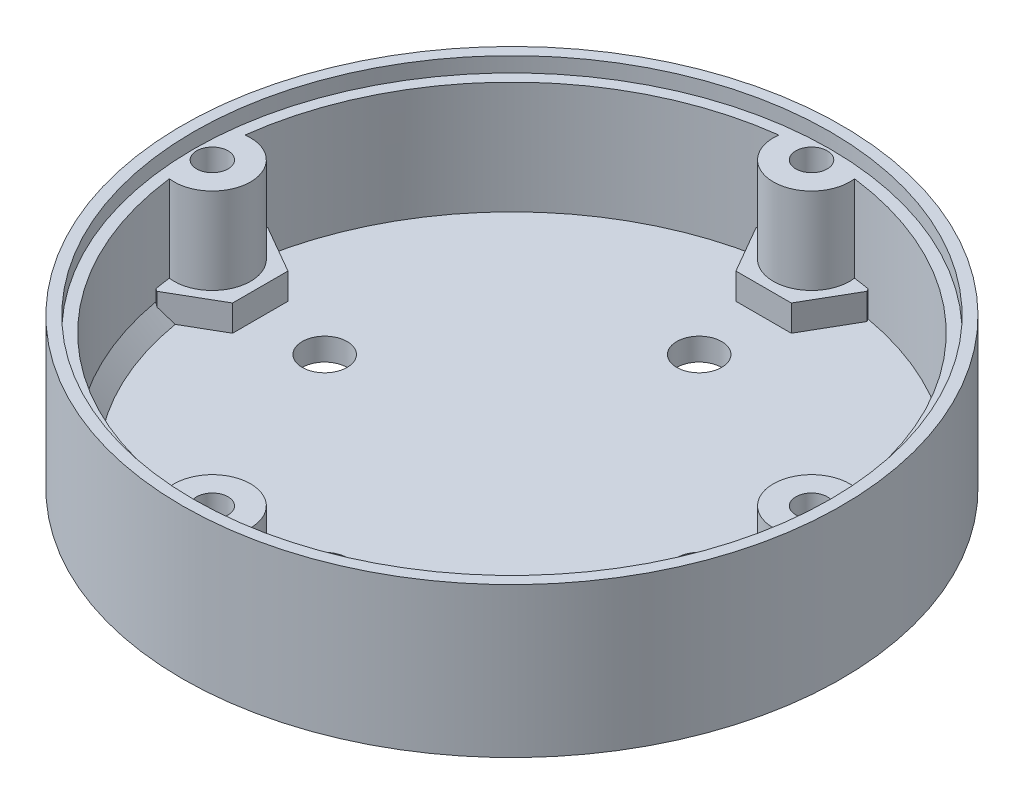
from build123d import *

# Parameters (mm, degrees)
CROQUIS1_R              = 44
SALIENTE_EXTRUIR1_DEPTH = 20
CROQUIS3_R              = 2.1
CORTAR_EXTRUIR3_DEPTH   = 81.199750623
CORTAR_EXTRUIR5_DEPTH   = 3.5
VACIADO1_START          = 3
VACIADO1_DEPTH          = 17
VACIADO1_START_2        = 6.5
VACIADO1_2_DEPTH        = 13.5
CROQUIS2_R              = 3
CORTAR_EXTRUIR1_DEPTH   = 66.360538553
CROQUIS4_R              = 42.5
CORTAR_EXTRUIR4_DEPTH   = 2
CHAFL_N1_SIZE           = 2


# Read off the part's stored shape, not the designer's step: Vaciado1
with BuildPart() as part:
    # Croquis1 → Saliente-Extruir1 (new body)
    with BuildSketch(Plane(origin=(0, 0, 0), x_dir=(1, 0, 0), z_dir=(0, 1, 0))):
        with Locations(Location((0, 0, 0), (0, 0, 270))):
            Circle(CROQUIS1_R)
    extrude(amount=SALIENTE_EXTRUIR1_DEPTH)

    # Croquis3 → Cortar-Extruir3 (cut, through all)
    with BuildSketch(Plane(origin=(0, 20, -20), x_dir=(1, 0, 0), z_dir=(0, -1, 0))):
        with Locations(Location((-40, 20, 0), (0, 0, 270))):
            Circle(CROQUIS3_R)
        with Locations(Location((0, 60, 0), (0, 0, 270))):
            Circle(CROQUIS3_R)
        with Locations(Location((40, 20, 0), (0, 0, 270))):
            Circle(CROQUIS3_R)
        with Locations(Location((0, -20, 0), (0, 0, 270))):
            Circle(CROQUIS3_R)
    extrude(amount=CORTAR_EXTRUIR3_DEPTH, mode=Mode.SUBTRACT)

    # Croquis5 → Cortar-Extruir5 (cut)
    with BuildSketch(Plane.XZ):
        Polygon((40, -3.92598183), (43.4, -1.962990915), (43.4, 1.962990915), (40, 3.92598183), (36.6, 1.962990915), (36.6, -1.962990915), align=None)
        Polygon((3.92598183, 40), (1.962990915, 43.4), (-1.962990915, 43.4), (-3.92598183, 40), (-1.962990915, 36.6), (1.962990915, 36.6), align=None)
        Polygon((-3.92598183, -40), (-1.962990915, -43.4), (1.962990915, -43.4), (3.92598183, -40), (1.962990915, -36.6), (-1.962990915, -36.6), align=None)
        Polygon((-40, 3.92598183), (-43.4, 1.962990915), (-43.4, -1.962990915), (-40, -3.92598183), (-36.6, -1.962990915), (-36.6, 1.962990915), align=None)
    extrude(amount=-CORTAR_EXTRUIR5_DEPTH, mode=Mode.SUBTRACT)

    # Vaciado1 outline → Vaciado1 (cut)
    with BuildSketch(Plane(origin=(0, 0, 0), x_dir=(1, 0, 0), z_dir=(0, 1, 0)).offset(VACIADO1_START)):
        with BuildLine():
            ThreePointArc((-7.178364733, 40.366707567), (-28.991378029, 28.991378029), (-40.366707567, 7.178364733))
            Line((-40.366707567, 7.178364733), (-40, 7.390083446))
            Line((-40, 7.390083446), (-33.6, 3.695041723))
            Line((-33.6, 3.695041723), (-33.6, -3.695041723))
            Line((-33.6, -3.695041723), (-40, -7.390083446))
            Line((-40, -7.390083446), (-40.366707567, -7.178364733))
            ThreePointArc((-40.366707567, -7.178364733), (-28.991378029, -28.991378029), (-7.178364733, -40.366707567))
            Line((-7.178364733, -40.366707567), (-7.390083446, -40))
            Line((-7.390083446, -40), (-3.695041723, -33.6))
            Line((-3.695041723, -33.6), (3.695041723, -33.6))
            Line((3.695041723, -33.6), (7.390083446, -40))
            Line((7.390083446, -40), (7.178364733, -40.366707567))
            ThreePointArc((7.178364733, -40.366707567), (28.991378029, -28.991378029), (40.366707567, -7.178364733))
            Line((40.366707567, -7.178364733), (40, -7.390083446))
            Line((40, -7.390083446), (33.6, -3.695041723))
            Line((33.6, -3.695041723), (33.6, 3.695041723))
            Line((33.6, 3.695041723), (40, 7.390083446))
            Line((40, 7.390083446), (40.366707567, 7.178364733))
            ThreePointArc((40.366707567, 7.178364733), (28.991378029, 28.991378029), (7.178364733, 40.366707567))
            Line((7.178364733, 40.366707567), (7.390083446, 40))
            Line((7.390083446, 40), (3.695041723, 33.6))
            Line((3.695041723, 33.6), (-3.695041723, 33.6))
            Line((-3.695041723, 33.6), (-7.390083446, 40))
            Line((-7.390083446, 40), (-7.178364733, 40.366707567))
        make_face()
    extrude(amount=VACIADO1_DEPTH, mode=Mode.SUBTRACT)

    # Vaciado1 2 outline → Vaciado1 2 (cut)
    with BuildSketch(Plane(origin=(0, 0, 0), x_dir=(1, 0, 0), z_dir=(0, 1, 0)).offset(VACIADO1_START_2)):
        with BuildLine():
            ThreePointArc((-40.366707567, 7.178364733), (-40.540965383, 6.118016497), (-40.687375, 5.053465703))
            ThreePointArc((-40.687375, 5.053465703), (-34.9, 0), (-40.687375, -5.053465703))
            ThreePointArc((-40.687375, -5.053465703), (-40.540965383, -6.118016497), (-40.366707567, -7.178364733))
            Line((-40.366707567, -7.178364733), (-40, -7.390083446))
            Line((-40, -7.390083446), (-33.6, -3.695041723))
            Line((-33.6, -3.695041723), (-33.6, 3.695041723))
            Line((-33.6, 3.695041723), (-40, 7.390083446))
            Line((-40, 7.390083446), (-40.366707567, 7.178364733))
        make_face()
        with BuildLine():
            ThreePointArc((-5.053465703, 40.687375), (-6.118016497, 40.540965383), (-7.178364733, 40.366707567))
            Line((-7.178364733, 40.366707567), (-7.390083446, 40))
            Line((-7.390083446, 40), (-3.695041723, 33.6))
            Line((-3.695041723, 33.6), (3.695041723, 33.6))
            Line((3.695041723, 33.6), (7.390083446, 40))
            Line((7.390083446, 40), (7.178364733, 40.366707567))
            ThreePointArc((7.178364733, 40.366707567), (6.118016497, 40.540965383), (5.053465703, 40.687375))
            ThreePointArc((5.053465703, 40.687375), (0, 34.9), (-5.053465703, 40.687375))
        make_face()
        with BuildLine():
            Line((-7.390083446, -40), (-7.178364733, -40.366707567))
            ThreePointArc((-7.178364733, -40.366707567), (-6.118016497, -40.540965383), (-5.053465703, -40.687375))
            ThreePointArc((-5.053465703, -40.687375), (0, -34.9), (5.053465703, -40.687375))
            ThreePointArc((5.053465703, -40.687375), (6.118016497, -40.540965383), (7.178364733, -40.366707567))
            Line((7.178364733, -40.366707567), (7.390083446, -40))
            Line((7.390083446, -40), (3.695041723, -33.6))
            Line((3.695041723, -33.6), (-3.695041723, -33.6))
            Line((-3.695041723, -33.6), (-7.390083446, -40))
        make_face()
        with BuildLine():
            ThreePointArc((40.687375, 5.053465703), (40.540965383, 6.118016497), (40.366707567, 7.178364733))
            Line((40.366707567, 7.178364733), (40, 7.390083446))
            Line((40, 7.390083446), (33.6, 3.695041723))
            Line((33.6, 3.695041723), (33.6, -3.695041723))
            Line((33.6, -3.695041723), (40, -7.390083446))
            Line((40, -7.390083446), (40.366707567, -7.178364733))
            ThreePointArc((40.366707567, -7.178364733), (40.540965383, -6.118016497), (40.687375, -5.053465703))
            ThreePointArc((40.687375, -5.053465703), (34.9, 0), (40.687375, 5.053465703))
        make_face()
    extrude(amount=VACIADO1_2_DEPTH, mode=Mode.SUBTRACT)

    # Croquis2 → Cortar-Extruir1 (cut, through all)
    with BuildSketch(Plane.XZ):
        with Locations(Location((0, 25, 0), (0, 0, 270))):
            Circle(CROQUIS2_R)
        with Locations(Location((25, 0, 0), (0, 0, 270))):
            Circle(CROQUIS2_R)
        with Locations(Location((0, -25, 0), (0, 0, 270))):
            Circle(CROQUIS2_R)
        with Locations(Location((-25, 0, 0), (0, 0, 270))):
            Circle(CROQUIS2_R)
    extrude(amount=-CORTAR_EXTRUIR1_DEPTH, mode=Mode.SUBTRACT)

    # Croquis4 → Cortar-Extruir4 (cut)
    with BuildSketch(Plane(origin=(0, 20, 0), x_dir=(1, 0, 0), z_dir=(0, 1, 0))):
        with Locations(Location((0, 0, 0), (0, 0, 270))):
            Circle(CROQUIS4_R)
    extrude(amount=-CORTAR_EXTRUIR4_DEPTH, mode=Mode.SUBTRACT)

    # Chaflán1
    chafl_n1_edges = [part.edges().sort_by_distance(p)[0] for p in [
        (-28.991378029, 3, 28.991378029),
    ]]
    chamfer(chafl_n1_edges, length=CHAFL_N1_SIZE)


solid = part.part
